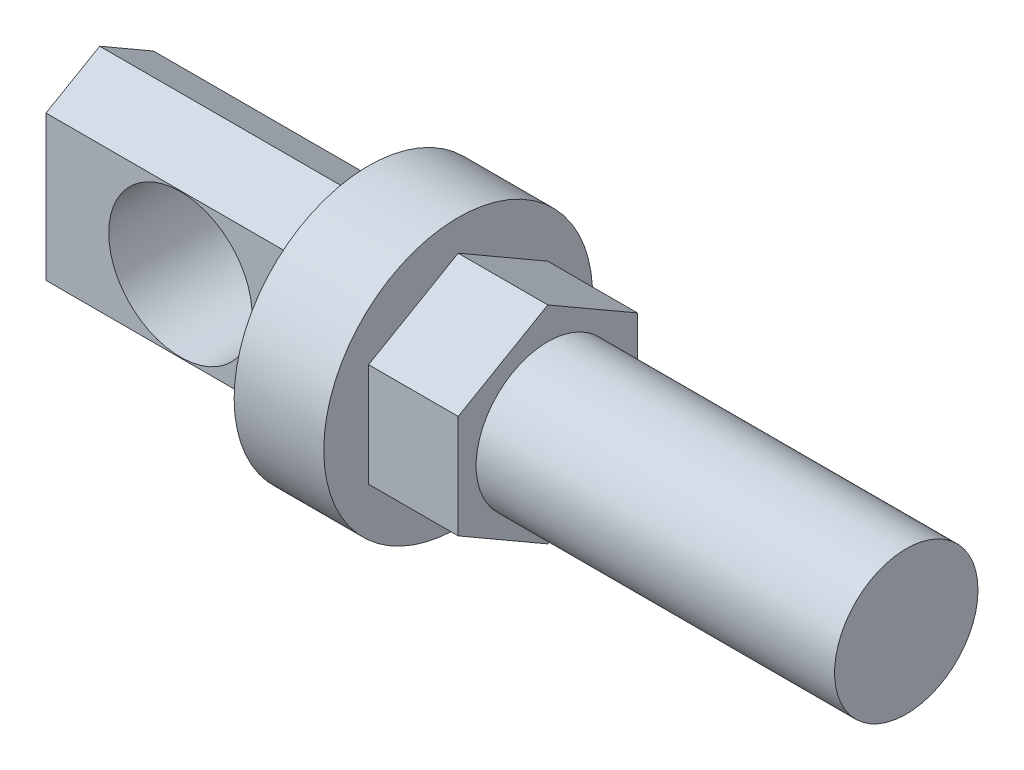
from build123d import *

# Parameters (mm, degrees)
EXTRUDE_1_DEPTH     = 10
SKETCH_2_R          = 8
EXTRUDE_2_DEPTH     = 40
SKETCH_5_R          = 15
EXTRUDE_4_DEPTH     = 10
EXTRUDE_3_DEPTH     = 30
CUT_EXTRUDE_1_REACH = 58.268
SKETCH_4_R          = 8


with BuildPart() as part:
    # Эскиз1 → Бобышка-Вытянуть1 (new body)
    with BuildSketch(Plane(origin=(0, 0, 0), x_dir=(0, 0, -1), z_dir=(1, 0, 0))):
        Polygon((0, 11.547005384), (-10, 5.773502692), (-10, -5.773502692), (0, -11.547005384), (10, -5.773502692), (10, 5.773502692), align=None)
    extrude(amount=EXTRUDE_1_DEPTH)

    # Эскиз2 → Бобышка-Вытянуть2 (add)
    with BuildSketch(Plane(origin=(10, 0, 0), x_dir=(0, 0, -1), z_dir=(1, 0, 0))):
        Circle(SKETCH_2_R)
    extrude(amount=EXTRUDE_2_DEPTH)

    # Эскиз5 → Бобышка-Вытянуть4 (add)
    with BuildSketch(Plane.ZY):
        Circle(SKETCH_5_R)
    extrude(amount=EXTRUDE_4_DEPTH)

    # Эскиз3 → Бобышка-Вытянуть3 (add)
    with BuildSketch(Plane.ZY.offset(10)):
        Polygon((0, 11.547005384), (-6.001748602, 8.081894213), (-6.001748602, -8.081894213), (0, -11.547005384), (5.991634546, -8.087733566), (5.991634546, 8.087733566), align=None)
    extrude(amount=EXTRUDE_3_DEPTH)

    # Эскиз4 → Вырез-Вытянуть1 (cut, up to next)
    with BuildSketch(Plane(origin=(0, 0, -6.001748602), x_dir=(-1, 0, 0), z_dir=(0, 0, -1)), mode=Mode.PRIVATE) as cut_extrude_1_sk1:
        with Locations((25, 0)):
            Circle(SKETCH_4_R)
    cut_extrude_1_tool1 = extrude(cut_extrude_1_sk1.sketch, amount=-CUT_EXTRUDE_1_REACH, mode=Mode.PRIVATE) & part.part
    add(cut_extrude_1_tool1.solids().sort_by_distance((-25, 0, -6.001749))[0], mode=Mode.SUBTRACT)


solid = part.part
